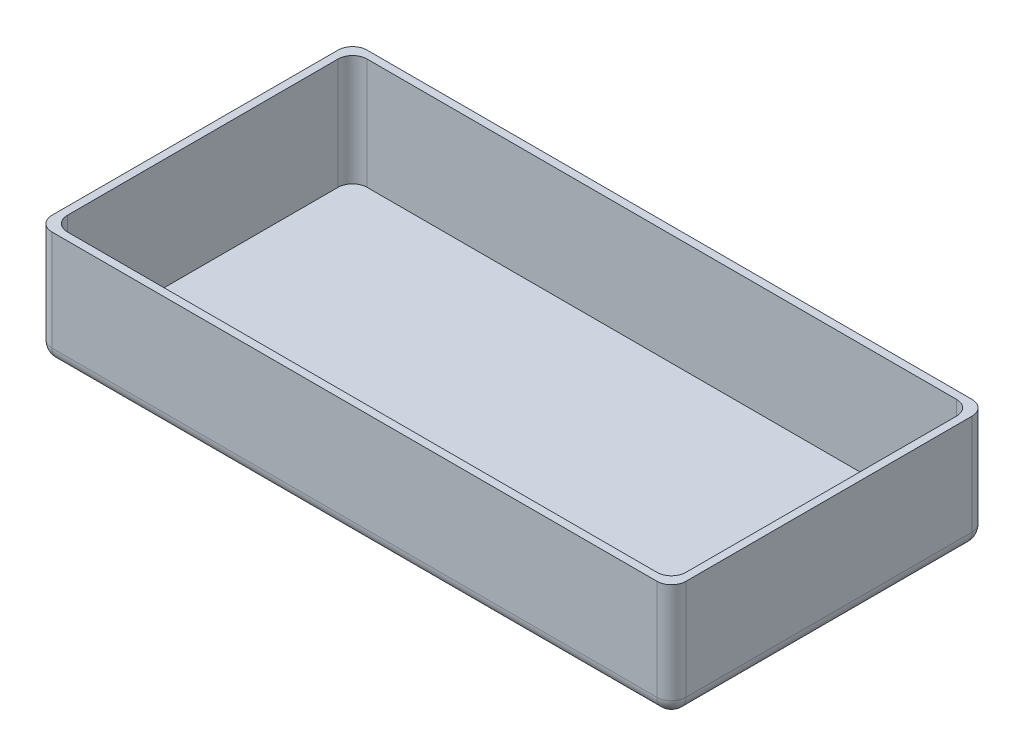
from build123d import *

# Parameters (mm, degrees)
SKETCH1_W           = 131.2
SKETCH1_H           = 65.2
SKETCH1_W_2         = 128
SKETCH1_H_2         = 62
BOSS_EXTRUDE1_DEPTH = 23
SKETCH2_W           = 131.2
SKETCH2_H           = 65.2
BOSS_EXTRUDE2_DEPTH = 0.8
FILLET1_R           = 3
FILLET2_R           = 3


with BuildPart() as part:
    # Sketch1 → Boss-Extrude1 (new body)
    with BuildSketch(Plane(origin=(0, 0, 0), x_dir=(1, 0, 0), z_dir=(0, 1, 0))):
        Rectangle(SKETCH1_W, SKETCH1_H)
        Rectangle(SKETCH1_W_2, SKETCH1_H_2, mode=Mode.SUBTRACT)
    extrude(amount=BOSS_EXTRUDE1_DEPTH)

    # Sketch2 → Boss-Extrude2 (add)
    with BuildSketch(Plane.XZ):
        Rectangle(SKETCH2_W, SKETCH2_H)
    extrude(amount=BOSS_EXTRUDE2_DEPTH)

    # Fillet1
    fillet1_edges = [part.edges().sort_by_distance(p)[0] for p in [
        (65.6, 11.1, -32.6),
        (-65.6, 11.1, -32.6),
        (-65.6, 11.1, 32.6),
        (-64, 11.5, 31),
        (65.6, 11.1, 32.6),
        (64, 11.5, 31),
        (64, 11.5, -31),
        (-64, 11.5, -31),
    ]]
    fillet(fillet1_edges, radius=FILLET1_R)

    # Fillet2
    fillet2_edges = [part.edges().sort_by_distance(p)[0] for p in [
        (64.721320344, -0.8, 31.721320344),
        (65.6, -0.8, 0),
        (64.721320344, -0.8, -31.721320344),
        (0, -0.8, -32.6),
        (-64.721320344, -0.8, -31.721320344),
        (-65.6, -0.8, 0),
        (-64.721320344, -0.8, 31.721320344),
        (0, -0.8, 32.6),
    ]]
    fillet(fillet2_edges, radius=FILLET2_R)


solid = part.part
